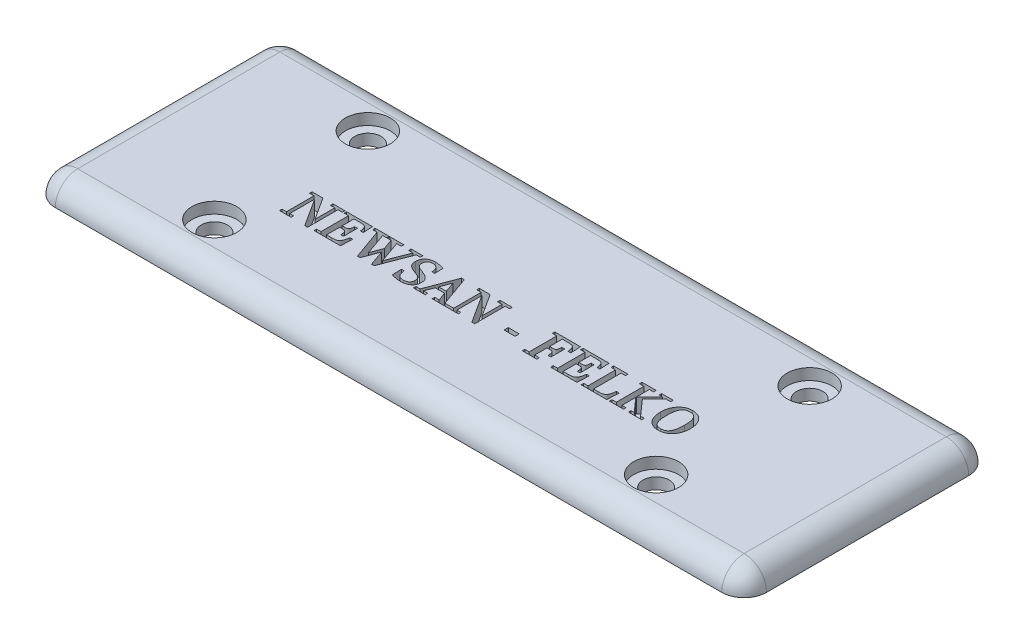
from build123d import *

# Parameters (mm, degrees)
CROQUIS1_W                = 95
CROQUIS1_H                = 33
SALIENTE_EXTRUIR1_DEPTH   = 3
CROQUIS2_R                = 1.75
CORTAR_EXTRUIR1_DEPTH     = 3
REDONDEO1_R               = 3
CORTAR_EXTRUIR2_START     = -2
CORTAR_EXTRUIR2_OUTLINE_W = 1.471220198
CORTAR_EXTRUIR2_OUTLINE_H = 0.565174626
CORTAR_EXTRUIR2_DEPTH     = 2
CROQUIS5_R                = 3
CORTAR_EXTRUIR3_DEPTH     = 1.5


# Read off the part's stored shape, not the designer's step: Cortar-Extruir2
with BuildPart() as part:
    # Croquis1 → Saliente-Extruir1 (new body)
    with BuildSketch(Plane(origin=(0, 0, 0), x_dir=(1, 0, 0), z_dir=(0, 1, 0))):
        Rectangle(CROQUIS1_W, CROQUIS1_H)
    extrude(amount=SALIENTE_EXTRUIR1_DEPTH)

    # Croquis2 → Cortar-Extruir1 (cut)
    with BuildSketch(Plane(origin=(0, 3, 0), x_dir=(1, 0, 0), z_dir=(0, 1, 0))):
        with Locations(Location((-29.5, 10.25, 0), (0, 0, 270))):
            Circle(CROQUIS2_R)
        with Locations(Location((-29.5, -10.25, 0), (0, 0, 270))):
            Circle(CROQUIS2_R)
        with Locations(Location((29.5, 10.25, 0), (0, 0, 270))):
            Circle(CROQUIS2_R)
        with Locations(Location((29.5, -10.25, 0), (0, 0, 270))):
            Circle(CROQUIS2_R)
    extrude(amount=-CORTAR_EXTRUIR1_DEPTH, mode=Mode.SUBTRACT)

    # Redondeo1
    redondeo1_edges = [part.edges().sort_by_distance(p)[0] for p in [
        (-47.5, 3, 0),
        (0, 3, 16.5),
        (47.5, 3, 0),
        (47.5, 1.5, 16.5),
        (-47.5, 1.5, 16.5),
        (-47.5, 1.5, -16.5),
        (47.5, 1.5, -16.5),
        (0, 3, -16.5),
    ]]
    fillet(redondeo1_edges, radius=REDONDEO1_R - 0.0001)  # a hair under: the kernel refuses the full size

    # Cortar-Extruir2 outline → Cortar-Extruir2 (cut)
    # profile 1 of 11: a face of its own
    with BuildSketch(Plane(origin=(0, 3, 0), x_dir=(1, 0, 0), z_dir=(0, 1, 0)).offset(CORTAR_EXTRUIR2_START)):
        with BuildLine():
            add(Edge.make_bspline(
                [(7.835082541, -2.552231705), (7.866288504, -2.552113847), (7.925474772, -2.551890313), (8.009068049, -2.548882373), (8.083044213, -2.5459401), (8.147689219, -2.540072055), (8.204919261, -2.530629364), (8.255269012, -2.515981768), (8.299614281, -2.49555415), (8.338205175, -2.468495475), (8.370599719, -2.432114827), (8.400430954, -2.387777593), (8.422836836, -2.331977531), (8.445401416, -2.265977584), (8.463525133, -2.183379744), (8.47880217, -2.081001435), (8.4916923, -1.956612994), (8.498255741, -1.866389899), (8.501811982, -1.817504692)],
                knots=[0, 0, 0, 0, 0.077872921, 0.147696373, 0.208740392, 0.262613455, 0.309594528, 0.353290378, 0.393054837, 0.43097135, 0.469961481, 0.51397114, 0.563648885, 0.619402434, 0.688009574, 0.774245034, 0.877680118, 1, 1, 1, 1], degree=3))
            Line((7.835082541, -2.552231705), (7.564858423, -2.552231705))
            Line((7.564858423, -2.552231705), (7.564858423, -0.856707828))
            Line((7.564858423, -0.856707828), (8.349921302, -0.856707828))
            add(Edge.make_bspline(
                [(9.363703287, -1.874022154), (9.356420458, -1.815981544), (9.342823038, -1.707616706), (9.318366911, -1.556693251), (9.291664283, -1.428944609), (9.262078086, -1.321808857), (9.229784985, -1.230873258), (9.189458998, -1.153614645), (9.144544526, -1.086293781), (9.092610664, -1.029418621), (9.032555359, -0.982754458), (8.96491433, -0.943158855), (8.887419443, -0.913858898), (8.801153012, -0.891699675), (8.704640053, -0.876826171), (8.597213604, -0.863745228), (8.477424181, -0.858675836), (8.393780831, -0.8573848), (8.349921302, -0.856707828)],
                knots=[0, 0, 0, 0, 0.104382199, 0.194886993, 0.272777312, 0.337141473, 0.393152238, 0.444605182, 0.492248799, 0.537232089, 0.581370096, 0.627501203, 0.676568608, 0.728679678, 0.786195024, 0.850702647, 0.921713901, 1, 1, 1, 1], degree=3))
            Line((9.363703287, -1.874022154), (9.731949879, -1.874022154))
            Line((9.731949879, -1.874022154), (9.663069221, -0.517603053))
            Line((9.663069221, -0.517603053), (6.239347309, -0.517603053))
            Line((6.239347309, -0.517603053), (6.239347309, -0.856707828))
            Line((6.239347309, -0.856707828), (6.824832898, -0.856707828))
            Line((6.824832898, -0.856707828), (6.824832898, -4.530342895))
            Line((6.824832898, -4.530342895), (6.239347309, -4.530342895))
            Line((6.239347309, -4.530342895), (6.239347309, -4.869447671))
            Line((6.239347309, -4.869447671), (8.178602743, -4.869447671))
            Line((8.178602743, -4.869447671), (8.178602743, -4.530342895))
            Line((8.178602743, -4.530342895), (7.564858423, -4.530342895))
            Line((7.564858423, -4.530342895), (7.564858423, -2.891336481))
            Line((7.564858423, -2.891336481), (7.835082541, -2.891336481))
            add(Edge.make_bspline(
                [(8.500928897, -3.682580957), (8.49796043, -3.63310797), (8.492442673, -3.54114809), (8.480893173, -3.413650898), (8.468637112, -3.307113751), (8.452565128, -3.219789064), (8.43388467, -3.148281025), (8.412354809, -3.087859967), (8.38502061, -3.038221891), (8.353335898, -2.997250043), (8.314796147, -2.96553747), (8.269455171, -2.940730304), (8.217233344, -2.921035443), (8.156844967, -2.909806022), (8.089023697, -2.900973612), (8.012375096, -2.895101878), (7.92666403, -2.891576316), (7.866583364, -2.891418976), (7.835082541, -2.891336481)],
                knots=[0, 0, 0, 0, 0.118776708, 0.220780927, 0.306799081, 0.375706699, 0.433376213, 0.483827635, 0.528984734, 0.568649537, 0.607220103, 0.647649254, 0.692072946, 0.740361906, 0.794441565, 0.856017857, 0.924508893, 1, 1, 1, 1], degree=3))
            Line((8.500928897, -3.682580957), (8.875357086, -3.682580957))
            Line((8.875357086, -3.682580957), (8.875357086, -1.817504692))
            Line((8.875357086, -1.817504692), (8.501811982, -1.817504692))
        make_face()
    # profile 2 of 11: a face of its own
    with BuildSketch(Plane(origin=(0, 3, 0), x_dir=(1, 0, 0), z_dir=(0, 1, 0)).offset(CORTAR_EXTRUIR2_START)):
        with BuildLine():
            add(Edge.make_bspline(
                [(11.621752533, -2.43919678), (11.652959095, -2.439081198), (11.712146498, -2.438861983), (11.79573225, -2.435825422), (11.869732046, -2.432973014), (11.93459281, -2.426800125), (11.99214388, -2.418185134), (12.042006815, -2.401632501), (12.086319973, -2.38172723), (12.124833344, -2.354533258), (12.157579152, -2.318105956), (12.186566297, -2.273266221), (12.209978149, -2.217671679), (12.23181563, -2.151372269), (12.250173593, -2.068887076), (12.265544721, -1.966794162), (12.278305763, -1.84298595), (12.284912257, -1.753059921), (12.288481975, -1.704469767)],
                knots=[0, 0, 0, 0, 0.077918038, 0.147781943, 0.208861328, 0.262765604, 0.310498151, 0.353734685, 0.393522182, 0.431460662, 0.470473383, 0.515123849, 0.564157341, 0.620640993, 0.689287881, 0.774847026, 0.878342037, 1, 1, 1, 1], degree=3))
            Line((11.621752533, -2.43919678), (11.351528415, -2.43919678))
            Line((11.351528415, -2.43919678), (11.351528415, -0.856707828))
            Line((11.351528415, -0.856707828), (12.165733111, -0.856707828))
            add(Edge.make_bspline(
                [(13.175099669, -1.817504692), (13.166967635, -1.763862747), (13.151687646, -1.663070207), (13.124285454, -1.5229055), (13.096578419, -1.403068763), (13.066719495, -1.301824405), (13.032219097, -1.216090898), (12.995154581, -1.140584045), (12.949567321, -1.077061803), (12.899407073, -1.022267291), (12.841292711, -0.977372591), (12.775169743, -0.939817417), (12.699469909, -0.910907252), (12.614157648, -0.890370995), (12.518840665, -0.874330837), (12.411964639, -0.864813032), (12.293011009, -0.85700623), (12.209609196, -0.856810695), (12.165733111, -0.856707828)],
                knots=[0, 0, 0, 0, 0.100276022, 0.188417382, 0.263906678, 0.327592325, 0.383263949, 0.434608959, 0.482616625, 0.527272883, 0.57146264, 0.617759396, 0.667371346, 0.720685132, 0.77972221, 0.84588167, 0.918921319, 1, 1, 1, 1], degree=3))
            Line((13.175099669, -1.817504692), (13.542463175, -1.817504692))
            Line((13.542463175, -1.817504692), (13.479764115, -0.517603053))
            Line((13.479764115, -0.517603053), (10.026017301, -0.517603053))
            Line((10.026017301, -0.517603053), (10.026017301, -0.856707828))
            Line((10.026017301, -0.856707828), (10.61150289, -0.856707828))
            Line((10.61150289, -0.856707828), (10.61150289, -4.530342895))
            Line((10.61150289, -4.530342895), (10.026017301, -4.530342895))
            Line((10.026017301, -4.530342895), (10.026017301, -4.869447671))
            Line((10.026017301, -4.869447671), (13.5530602, -4.869447671))
            Line((13.5530602, -4.869447671), (13.61575926, -3.286958719))
            Line((13.61575926, -3.286958719), (13.248395753, -3.286958719))
            add(Edge.make_bspline(
                [(12.01384243, -4.530342895), (12.050935719, -4.530272261), (12.122197606, -4.53013656), (12.224654922, -4.526377659), (12.318579198, -4.521118292), (12.429705821, -4.512537354), (12.554676943, -4.493761583), (12.689322561, -4.456662392), (12.804558265, -4.403059107), (12.885313216, -4.342725689), (12.94011006, -4.285563151), (12.977829431, -4.235810475), (13.013184662, -4.179936696), (13.046128662, -4.117283965), (13.07658388, -4.047473747), (13.106123948, -3.970848828), (13.131193459, -3.886163468), (13.155408694, -3.793105207), (13.178336733, -3.687827552), (13.202084485, -3.568333583), (13.225912679, -3.432891603), (13.240636129, -3.337324798), (13.248395753, -3.286958719)],
                knots=[0, 0, 0, 0, 0.05445262, 0.104611819, 0.150493048, 0.192553926, 0.268220917, 0.335654327, 0.396929789, 0.45371437, 0.482445036, 0.512956787, 0.545206301, 0.579422652, 0.616763016, 0.656973875, 0.699898362, 0.746331873, 0.798126817, 0.858046255, 0.925186852, 1, 1, 1, 1], degree=3))
            Line((12.01384243, -4.530342895), (11.351528415, -4.530342895))
            Line((11.351528415, -4.530342895), (11.351528415, -2.778301556))
            Line((11.351528415, -2.778301556), (11.621752533, -2.778301556))
            add(Edge.make_bspline(
                [(12.287598889, -3.569546032), (12.284624578, -3.520073768), (12.27909596, -3.428115232), (12.267641733, -3.300900451), (12.255228166, -3.19467753), (12.239240333, -3.107636587), (12.220553547, -3.03612932), (12.199025052, -2.975708101), (12.171690548, -2.926070042), (12.140005901, -2.885098251), (12.101466144, -2.853385447), (12.05612513, -2.828579219), (12.003903487, -2.808880362), (11.943514315, -2.797668087), (11.875696572, -2.788759618), (11.799018502, -2.783228766), (11.713363392, -2.778202476), (11.653258765, -2.778267481), (11.621752533, -2.778301556)],
                knots=[0, 0, 0, 0, 0.118856032, 0.220928374, 0.306303417, 0.375257054, 0.432965082, 0.483450198, 0.528637455, 0.568328747, 0.606925072, 0.647381224, 0.691834584, 0.740155793, 0.794271569, 0.855888985, 0.924458477, 1, 1, 1, 1], degree=3))
            Line((12.287598889, -3.569546032), (12.662027079, -3.569546032))
            Line((12.662027079, -3.569546032), (12.662027079, -1.704469767))
            Line((12.662027079, -1.704469767), (12.288481975, -1.704469767))
        make_face()
    # profile 3 of 11: a face of its own
    with BuildSketch(Plane(origin=(0, 3, 0), x_dir=(1, 0, 0), z_dir=(0, 1, 0)).offset(CORTAR_EXTRUIR2_START)):
        with BuildLine():
            add(Edge.make_bspline(
                [(15.9947912, -4.530342895), (16.031886137, -4.530302023), (16.103445412, -4.530223176), (16.206159412, -4.526044445), (16.300441138, -4.522282286), (16.411529282, -4.513276875), (16.536518596, -4.494710847), (16.671387249, -4.457386318), (16.787753514, -4.403585411), (16.870034086, -4.343055689), (16.926327034, -4.285593985), (16.964817981, -4.236238656), (17.00018691, -4.180604524), (17.03408479, -4.119517972), (17.0651941, -4.050360621), (17.093832869, -3.973295837), (17.120503051, -3.887473215), (17.145048266, -3.792189659), (17.169161263, -3.68533328), (17.191570286, -3.565030097), (17.214861898, -3.430879011), (17.228419898, -3.33645149), (17.23552612, -3.286958719)],
                knots=[0, 0, 0, 0, 0.054289296, 0.104728649, 0.150449938, 0.192384659, 0.267824697, 0.335055849, 0.396536747, 0.454444531, 0.483388805, 0.514073344, 0.545863236, 0.57980238, 0.616244569, 0.656737955, 0.700072516, 0.7477262, 0.800721224, 0.860378538, 0.926819501, 1, 1, 1, 1], degree=3))
            Line((15.9947912, -4.530342895), (15.420785721, -4.530342895))
            Line((15.420785721, -4.530342895), (15.420785721, -0.856707828))
            Line((15.420785721, -0.856707828), (16.005388224, -0.856707828))
            Line((16.005388224, -0.856707828), (16.005388224, -0.517603053))
            Line((16.005388224, -0.517603053), (14.095274606, -0.517603053))
            Line((14.095274606, -0.517603053), (14.095274606, -0.856707828))
            Line((14.095274606, -0.856707828), (14.680760195, -0.856707828))
            Line((14.680760195, -0.856707828), (14.680760195, -4.530342895))
            Line((14.680760195, -4.530342895), (14.095274606, -4.530342895))
            Line((14.095274606, -4.530342895), (14.095274606, -4.869447671))
            Line((14.095274606, -4.869447671), (17.53400897, -4.869447671))
            Line((17.53400897, -4.869447671), (17.602889627, -3.286958719))
            Line((17.602889627, -3.286958719), (17.23552612, -3.286958719))
        make_face()
    # profile 4 of 11: a face of its own
    with BuildSketch(Plane(origin=(0, 3, 0), x_dir=(1, 0, 0), z_dir=(0, 1, 0)).offset(CORTAR_EXTRUIR2_START)):
        with BuildLine():
            add(Edge.make_bspline(
                [(24.466228988, -4.982482596), (24.395161306, -4.98084055), (24.256186713, -4.977629488), (24.053124117, -4.945853801), (23.85989807, -4.898597975), (23.677928445, -4.828926583), (23.507889345, -4.741164859), (23.349355601, -4.636509128), (23.204352495, -4.513959128), (23.071714135, -4.375336077), (22.953564501, -4.22011666), (22.848440055, -4.049741034), (22.760256751, -3.863123608), (22.683186247, -3.663234225), (22.625005284, -3.448564465), (22.582664803, -3.221198121), (22.55669011, -2.981423061), (22.553388253, -2.817223112), (22.551699944, -2.733264203)],
                knots=[0, 0, 0, 0, 0.064052732, 0.125256685, 0.184949902, 0.243184605, 0.300538688, 0.357239491, 0.414146296, 0.471421664, 0.529941342, 0.58977551, 0.651644441, 0.715845572, 0.782770124, 0.851923218, 0.924285207, 1, 1, 1, 1], degree=3))
            add(Edge.make_bspline(
                [(26.489377531, -2.651137265), (26.487961572, -2.731855978), (26.485174417, -2.890741514), (26.459855601, -3.124590241), (26.418349533, -3.349478219), (26.361465534, -3.564986378), (26.28807347, -3.769070102), (26.200386607, -3.961202442), (26.093891164, -4.138396932), (25.974546558, -4.303517705), (25.837571879, -4.452777858), (25.684754035, -4.585618609), (25.516816919, -4.703463811), (25.364101969, -4.785453859), (25.235618609, -4.843451135), (25.134720478, -4.880004708), (25.031182832, -4.912392069), (24.924224578, -4.937430849), (24.814405038, -4.958272282), (24.701097712, -4.97183758), (24.584722312, -4.981252531), (24.505987345, -4.982069869), (24.466228988, -4.982482596)],
                knots=[0, 0, 0, 0, 0.069727241, 0.137250082, 0.20294958, 0.26717328, 0.329603704, 0.390143467, 0.449335206, 0.507939886, 0.565905272, 0.623950955, 0.68258488, 0.74279087, 0.773418736, 0.804318911, 0.835453715, 0.867100623, 0.899176948, 0.931986055, 0.965655378, 1, 1, 1, 1], degree=3))
            add(Edge.make_bspline(
                [(24.527161878, -0.404568128), (24.600566145, -0.406613079), (24.744804321, -0.410631374), (24.955686467, -0.441968278), (25.156300449, -0.494051226), (25.345069556, -0.567843401), (25.522282875, -0.658640292), (25.685534164, -0.766725988), (25.834324132, -0.891634638), (25.968854037, -1.032257284), (26.0881258, -1.188870188), (26.194268235, -1.358953396), (26.282629786, -1.544695425), (26.358077641, -1.74266619), (26.417045789, -1.953408339), (26.459401672, -2.175803204), (26.484086981, -2.40979122), (26.487588848, -2.56954052), (26.489377531, -2.651137265)],
                knots=[0, 0, 0, 0, 0.065594082, 0.128891289, 0.190095919, 0.250491485, 0.309685178, 0.367775572, 0.425115623, 0.482994079, 0.541358546, 0.600795024, 0.661872828, 0.724913567, 0.789971373, 0.857212468, 0.927066988, 1, 1, 1, 1], degree=3))
            add(Edge.make_bspline(
                [(22.551699944, -2.733264203), (22.553235755, -2.646349136), (22.556242523, -2.476189322), (22.584400818, -2.227887622), (22.628697837, -1.992541337), (22.692402153, -1.771229238), (22.773072202, -1.564450556), (22.867133253, -1.371728055), (22.977127897, -1.195222634), (23.101243441, -1.034432402), (23.238808203, -0.890100635), (23.390456546, -0.763710292), (23.55403595, -0.654734922), (23.730044523, -0.56428582), (23.916510475, -0.492649888), (24.112511169, -0.441360384), (24.317208483, -0.410863204), (24.456411876, -0.40668944), (24.527161878, -0.404568128)],
                knots=[0, 0, 0, 0, 0.07600561, 0.148801595, 0.218290823, 0.285281947, 0.349932467, 0.412233206, 0.472609267, 0.531531367, 0.58962847, 0.646665346, 0.703870537, 0.761222741, 0.81942076, 0.878255021, 0.938123222, 1, 1, 1, 1], degree=3))
        make_face()
        with BuildLine():
            add(Edge.make_bspline(
                [(24.506850914, -0.743672903), (24.454962477, -0.745249034), (24.353310879, -0.74833674), (24.205056598, -0.771067834), (24.064711375, -0.811792093), (23.956897776, -0.866733386), (23.875566723, -0.921389765), (23.817489254, -0.971679239), (23.760237764, -1.028188659), (23.706567339, -1.094173016), (23.654717145, -1.168725131), (23.60720858, -1.254477764), (23.562501746, -1.350426277), (23.521140373, -1.45696318), (23.482660788, -1.573735655), (23.451169734, -1.701847831), (23.421303519, -1.840051506), (23.397865575, -1.989553585), (23.379637497, -2.151334742), (23.365192534, -2.326525803), (23.357672048, -2.516252529), (23.356696025, -2.64759914), (23.3561907, -2.715602496)],
                knots=[0, 0, 0, 0, 0.060033413, 0.117607943, 0.173109435, 0.22841089, 0.256850895, 0.286336645, 0.31716911, 0.349838151, 0.38461155, 0.422132989, 0.463127675, 0.507029748, 0.554321777, 0.605299346, 0.659617346, 0.717917939, 0.780328288, 0.847997611, 0.921302327, 1, 1, 1, 1], degree=3))
            add(Edge.make_bspline(
                [(25.684886775, -2.674097484), (25.684413766, -2.609623336), (25.683497601, -2.484744207), (25.675468063, -2.303612042), (25.662524514, -2.134509733), (25.643899271, -1.977245784), (25.621205733, -1.83106894), (25.593735601, -1.696203217), (25.563469506, -1.57177508), (25.527178685, -1.458660508), (25.486782901, -1.355879009), (25.445999289, -1.261617553), (25.39701747, -1.179400611), (25.347150815, -1.105216363), (25.292545656, -1.040551845), (25.236007027, -0.982814773), (25.176589839, -0.931854129), (25.113505704, -0.888640516), (25.047537329, -0.851325806), (24.978996742, -0.819233135), (24.906301843, -0.794513152), (24.804733113, -0.768948669), (24.671059802, -0.747881749), (24.562278138, -0.745093561), (24.506850914, -0.743672903)],
                knots=[0, 0, 0, 0, 0.074972217, 0.145212699, 0.210794604, 0.272147781, 0.32932531, 0.382762456, 0.432160301, 0.47816842, 0.520759141, 0.560590473, 0.597402379, 0.631868439, 0.664432592, 0.69565765, 0.725768974, 0.755298762, 0.784425026, 0.813831549, 0.843168258, 0.873554612, 0.935572627, 1, 1, 1, 1], degree=3))
            add(Edge.make_bspline(
                [(24.480358354, -4.64337782), (24.536944307, -4.641863125), (24.647114241, -4.638914091), (24.782170741, -4.619344044), (24.884281634, -4.593217012), (24.95694148, -4.567787005), (25.027173016, -4.536547049), (25.094001025, -4.498291186), (25.159203741, -4.454390307), (25.220072169, -4.401526122), (25.278432886, -4.342108199), (25.334752325, -4.275649796), (25.386689796, -4.199590451), (25.436927262, -4.115029551), (25.479721621, -4.018849064), (25.522126149, -3.914468401), (25.558889063, -3.798974573), (25.591309959, -3.672738976), (25.619299333, -3.535656432), (25.643425514, -3.38753279), (25.661345334, -3.22716658), (25.67581496, -3.054345213), (25.683408342, -2.868444913), (25.684382897, -2.740334818), (25.684886775, -2.674097484)],
                knots=[0, 0, 0, 0, 0.064489388, 0.125557513, 0.155015933, 0.184514449, 0.213198429, 0.242495914, 0.272182727, 0.302642504, 0.334196862, 0.367060094, 0.401775644, 0.4390645, 0.478994874, 0.521610414, 0.567447055, 0.617005525, 0.670106882, 0.726865271, 0.788000641, 0.853980099, 0.924502679, 1, 1, 1, 1], degree=3))
            add(Edge.make_bspline(
                [(23.3561907, -2.715602496), (23.356625303, -2.782139624), (23.357464076, -2.910554591), (23.365922982, -3.096045352), (23.377273621, -3.267900143), (23.39637422, -3.426278208), (23.418738865, -3.572865962), (23.447390826, -3.707936372), (23.478845257, -3.833050282), (23.514689649, -3.947923091), (23.555301973, -4.051858584), (23.598574426, -4.145586935), (23.645190828, -4.228597746), (23.694903861, -4.302077429), (23.748206084, -4.36565792), (23.803274163, -4.421595419), (23.859681067, -4.470915386), (23.938609961, -4.524488453), (24.04324481, -4.577310493), (24.179037255, -4.618108606), (24.325678725, -4.639862702), (24.427299405, -4.642172047), (24.480358354, -4.64337782)],
                knots=[0, 0, 0, 0, 0.078657401, 0.151806784, 0.219496477, 0.282217665, 0.340347994, 0.394745788, 0.445389451, 0.492827568, 0.536902847, 0.57722709, 0.614781646, 0.649338274, 0.681954902, 0.712715998, 0.742083255, 0.770366505, 0.825305959, 0.879907089, 0.937296193, 1, 1, 1, 1], degree=3))
        make_face(mode=Mode.SUBTRACT)
    # profile 5 of 11: a face of its own
    with BuildSketch(Plane(origin=(0, 3, 0), x_dir=(1, 0, 0), z_dir=(0, 1, 0)).offset(CORTAR_EXTRUIR2_START)):
        with BuildLine():
            add(Edge.make_bspline(
                [(-10.891625448, -3.513028569), (-10.884983123, -3.573173923), (-10.872394696, -3.687160428), (-10.843672534, -3.846893359), (-10.807928341, -3.985864073), (-10.764970196, -4.10498613), (-10.713785072, -4.206093813), (-10.66152868, -4.295204136), (-10.603738516, -4.371945156), (-10.541593659, -4.436979002), (-10.475429669, -4.491290304), (-10.406635581, -4.536726858), (-10.333790337, -4.572430173), (-10.257663459, -4.599963479), (-10.177465881, -4.618772882), (-10.094298088, -4.632897638), (-10.007570476, -4.642158595), (-9.948514088, -4.642966664), (-9.918465389, -4.64337782)],
                knots=[0, 0, 0, 0, 0.107965712, 0.204614875, 0.289346858, 0.363804405, 0.430054362, 0.491315945, 0.547945155, 0.601074609, 0.651452717, 0.700408463, 0.747864388, 0.795886799, 0.844557054, 0.894646758, 0.946394828, 1, 1, 1, 1], degree=3))
            Line((-10.891625448, -3.513028569), (-11.258988955, -3.513028569))
            Line((-11.258988955, -3.513028569), (-11.220133199, -4.754646575))
            add(Edge.make_bspline(
                [(-9.95643806, -4.982482596), (-10.008561911, -4.981856706), (-10.114404875, -4.98058577), (-10.27436205, -4.968322691), (-10.437074962, -4.950191178), (-10.599002704, -4.923706102), (-10.756080204, -4.89187386), (-10.908621179, -4.857552487), (-11.062753673, -4.812698569), (-11.165614226, -4.774756783), (-11.220133199, -4.754646575)],
                knots=[0, 0, 0, 0, 0.121139214, 0.245985918, 0.372701109, 0.501612211, 0.627212255, 0.745219209, 0.864959046, 1, 1, 1, 1], degree=3))
            add(Edge.make_bspline(
                [(-8.378364534, -3.717021285), (-8.379430978, -3.764189326), (-8.381520123, -3.856590655), (-8.401467654, -3.991589831), (-8.433956845, -4.119596024), (-8.480060138, -4.240148079), (-8.538720075, -4.353007122), (-8.609452923, -4.458246214), (-8.694783155, -4.553826126), (-8.790763508, -4.642748277), (-8.900148346, -4.720852177), (-9.020067541, -4.790782977), (-9.152521605, -4.847981933), (-9.294431587, -4.898054666), (-9.447151902, -4.935489479), (-9.60890872, -4.962510296), (-9.779738897, -4.979865491), (-9.896639726, -4.981596918), (-9.95643806, -4.982482596)],
                knots=[0, 0, 0, 0, 0.061917728, 0.121295699, 0.178776797, 0.235068933, 0.290403661, 0.345520511, 0.401130082, 0.458319197, 0.51701611, 0.577294735, 0.640298906, 0.706201906, 0.774746421, 0.846505096, 0.921482683, 1, 1, 1, 1], degree=3))
            add(Edge.make_bspline(
                [(-9.600554662, -2.389744), (-9.524142129, -2.419929086), (-9.372951631, -2.479653557), (-9.187552472, -2.560143903), (-9.044908474, -2.630140754), (-8.943815131, -2.689521271), (-8.848142562, -2.75591954), (-8.75837522, -2.829085655), (-8.674215256, -2.908400627), (-8.600237626, -2.996959344), (-8.535340746, -3.093224662), (-8.478968701, -3.197184805), (-8.433372944, -3.311334335), (-8.401112171, -3.436494865), (-8.381317909, -3.573035507), (-8.379374312, -3.667791649), (-8.378364534, -3.717021285)],
                knots=[0, 0, 0, 0, 0.12623985, 0.249779259, 0.310463001, 0.370272329, 0.429745493, 0.489225536, 0.548088419, 0.60715947, 0.666121324, 0.726225806, 0.788547809, 0.854482743, 0.924397917, 1, 1, 1, 1], degree=3))
            add(Edge.make_bspline(
                [(-10.580779404, -1.464270551), (-10.580013467, -1.499638688), (-10.578552173, -1.567115836), (-10.565452071, -1.66282323), (-10.54362556, -1.748112447), (-10.512281837, -1.823436985), (-10.472799326, -1.890479098), (-10.426095479, -1.951143521), (-10.373131416, -2.006829514), (-10.313001324, -2.05754925), (-10.246668813, -2.104287551), (-10.17354309, -2.147290962), (-10.095081637, -2.189017853), (-10.009571581, -2.227805777), (-9.91671856, -2.265275464), (-9.817822779, -2.306069896), (-9.711385315, -2.34745429), (-9.638248325, -2.37536121), (-9.600554662, -2.389744)],
                knots=[0, 0, 0, 0, 0.07235237, 0.138037569, 0.197215327, 0.252034976, 0.304417265, 0.355986131, 0.408396124, 0.461387991, 0.516711746, 0.574257236, 0.634888912, 0.698505626, 0.766300592, 0.839797535, 0.917434151, 1, 1, 1, 1], degree=3))
            add(Edge.make_bspline(
                [(-9.818676745, -0.743672903), (-9.850198762, -0.744053974), (-9.911022904, -0.74478928), (-9.998646914, -0.753969316), (-10.079040373, -0.767648795), (-10.152105667, -0.787047384), (-10.218766079, -0.81204133), (-10.279275851, -0.842872691), (-10.335164739, -0.878638115), (-10.385492585, -0.919937948), (-10.42991469, -0.967393738), (-10.469562317, -1.020100194), (-10.50280535, -1.079692827), (-10.531299014, -1.145251678), (-10.553088543, -1.217005621), (-10.568937935, -1.294448418), (-10.578690057, -1.377482108), (-10.580070107, -1.434807374), (-10.580779404, -1.464270551)],
                knots=[0, 0, 0, 0, 0.078682006, 0.151822946, 0.219739189, 0.282145484, 0.340303312, 0.397174116, 0.45140917, 0.505713914, 0.559272287, 0.613372682, 0.669991159, 0.729253348, 0.791564333, 0.856868676, 0.92643552, 1, 1, 1, 1], degree=3))
            add(Edge.make_bspline(
                [(-8.917929685, -1.760987229), (-8.923570191, -1.705590497), (-8.934230277, -1.600895281), (-8.957410849, -1.454292062), (-8.991273816, -1.328562536), (-9.03101528, -1.22177685), (-9.077059035, -1.130696828), (-9.127159524, -1.052032825), (-9.181574284, -0.983860681), (-9.239931233, -0.925926282), (-9.302945298, -0.878197506), (-9.367983766, -0.83636926), (-9.438578757, -0.806216614), (-9.535683681, -0.774353418), (-9.662888327, -0.749128133), (-9.76645337, -0.745501605), (-9.818676745, -0.743672903)],
                knots=[0, 0, 0, 0, 0.108739489, 0.205508589, 0.289450972, 0.36258282, 0.427622094, 0.488374484, 0.544392793, 0.597641091, 0.648460434, 0.698546265, 0.748214733, 0.797839941, 0.89805942, 1, 1, 1, 1], degree=3))
            Line((-8.917929685, -1.760987229), (-8.547916922, -1.760987229))
            Line((-8.547916922, -1.760987229), (-8.585006507, -0.627105636))
            add(Edge.make_bspline(
                [(-9.798365781, -0.404568128), (-9.752130263, -0.405279202), (-9.656309834, -0.406752862), (-9.509661981, -0.418237015), (-9.35829409, -0.433794341), (-9.20776749, -0.459473865), (-9.06145944, -0.487569598), (-8.94259242, -0.51679848), (-8.846094252, -0.542730455), (-8.766411007, -0.566951316), (-8.678320414, -0.595016223), (-8.617049574, -0.616086451), (-8.585006507, -0.627105636)],
                knots=[0, 0, 0, 0, 0.111895749, 0.231897445, 0.355897725, 0.480057559, 0.601342597, 0.71643192, 0.77623362, 0.84318026, 0.917987327, 1, 1, 1, 1], degree=3))
            add(Edge.make_bspline(
                [(-11.227197882, -1.66384784), (-11.225875566, -1.618178573), (-11.223273131, -1.528297454), (-11.206754823, -1.396247664), (-11.177164677, -1.27047143), (-11.137573878, -1.150490704), (-11.086670297, -1.037358836), (-11.02361352, -0.932359685), (-10.948912261, -0.836563731), (-10.863232665, -0.749261304), (-10.766864119, -0.670519651), (-10.659228109, -0.601439155), (-10.541060402, -0.542152209), (-10.412308408, -0.492916298), (-10.273301531, -0.452773358), (-10.123592301, -0.425486301), (-9.964265054, -0.406870838), (-9.854645932, -0.405349306), (-9.798365781, -0.404568128)],
                knots=[0, 0, 0, 0, 0.063530284, 0.125033166, 0.184725257, 0.242991791, 0.300531575, 0.356919108, 0.412941235, 0.469112795, 0.526731195, 0.585677141, 0.646654394, 0.71029937, 0.77717236, 0.84759989, 0.921755429, 1, 1, 1, 1], degree=3))
            add(Edge.make_bspline(
                [(-10.050045107, -2.95226937), (-10.123242765, -2.924499338), (-10.269808663, -2.868894559), (-10.449869991, -2.792126335), (-10.590376701, -2.725686101), (-10.688554784, -2.667244926), (-10.782056166, -2.60500617), (-10.868261801, -2.535201172), (-10.948231742, -2.459235352), (-11.017601358, -2.37364493), (-11.080011099, -2.281501007), (-11.133839161, -2.180745879), (-11.176728556, -2.069155636), (-11.206321687, -1.945083331), (-11.223763344, -1.808583343), (-11.226023104, -1.713354379), (-11.227197882, -1.66384784)],
                knots=[0, 0, 0, 0, 0.123807193, 0.247902909, 0.309534555, 0.369419997, 0.428430407, 0.487033545, 0.544652, 0.602533177, 0.660897272, 0.720461543, 0.782799531, 0.849420035, 0.921718219, 1, 1, 1, 1], degree=3))
            add(Edge.make_bspline(
                [(-9.053924829, -3.882158246), (-9.054665725, -3.847372704), (-9.0560782, -3.781056107), (-9.069593754, -3.686320506), (-9.090889689, -3.601216581), (-9.1225558, -3.525395305), (-9.162473303, -3.457607013), (-9.207920875, -3.394226357), (-9.262835248, -3.337926324), (-9.323380615, -3.285329948), (-9.390975498, -3.23642386), (-9.466461459, -3.191820009), (-9.548701102, -3.149286145), (-9.671192584, -3.095678597), (-9.839178555, -3.030511211), (-9.97756365, -2.979163548), (-10.050045107, -2.95226937)],
                knots=[0, 0, 0, 0, 0.070332836, 0.134085429, 0.193160766, 0.247351868, 0.299648065, 0.352056031, 0.404707034, 0.458319169, 0.514185815, 0.573216113, 0.6355398, 0.701385708, 0.84359588, 1, 1, 1, 1], degree=3))
            add(Edge.make_bspline(
                [(-9.918465389, -4.64337782), (-9.880459643, -4.642787001), (-9.807233456, -4.641648661), (-9.702246177, -4.630594231), (-9.606169272, -4.614908119), (-9.519734651, -4.589574918), (-9.441682137, -4.558783435), (-9.371251489, -4.522369765), (-9.308076388, -4.480763732), (-9.25195076, -4.433732938), (-9.203057009, -4.381226625), (-9.160985331, -4.323667261), (-9.127788376, -4.260157538), (-9.100014565, -4.192518351), (-9.079186727, -4.120202), (-9.064226487, -4.043977313), (-9.055183239, -3.964210951), (-9.054349559, -3.909852103), (-9.053924829, -3.882158246)],
                knots=[0, 0, 0, 0, 0.08652257, 0.166704213, 0.240218807, 0.307902186, 0.371391851, 0.431060807, 0.488142918, 0.543335638, 0.597409583, 0.651183484, 0.705170088, 0.760195626, 0.817474233, 0.876243863, 0.936950748, 1, 1, 1, 1], degree=3))
        make_face()
    # profile 6 of 11: a face of its own
    with BuildSketch(Plane(origin=(0, 3, 0), x_dir=(1, 0, 0), z_dir=(0, 1, 0)).offset(CORTAR_EXTRUIR2_START)):
        with BuildLine():
            add(Edge.make_bspline(
                [(-19.971509044, -2.43919678), (-19.940302483, -2.439081198), (-19.881115079, -2.438861983), (-19.797529328, -2.435825422), (-19.723529532, -2.432973014), (-19.658668768, -2.426800125), (-19.601117698, -2.418185134), (-19.551254763, -2.401632501), (-19.506941605, -2.38172723), (-19.468428234, -2.354533258), (-19.435682425, -2.318105956), (-19.406695281, -2.273266221), (-19.383283429, -2.217671679), (-19.361445947, -2.151372269), (-19.343087985, -2.068887076), (-19.327716857, -1.966794162), (-19.314955815, -1.84298595), (-19.308349321, -1.753059921), (-19.304779603, -1.704469767)],
                knots=[0, 0, 0, 0, 0.077918038, 0.147781943, 0.208861328, 0.262765604, 0.310498151, 0.353734685, 0.393522182, 0.431460662, 0.470473383, 0.515123849, 0.564157341, 0.620640993, 0.689287881, 0.774847026, 0.878342037, 1, 1, 1, 1], degree=3))
            Line((-19.971509044, -2.43919678), (-20.241733162, -2.43919678))
            Line((-20.241733162, -2.43919678), (-20.241733162, -0.856707828))
            Line((-20.241733162, -0.856707828), (-19.427528467, -0.856707828))
            add(Edge.make_bspline(
                [(-18.418161909, -1.817504692), (-18.426293943, -1.763862747), (-18.441573931, -1.663070207), (-18.468976124, -1.5229055), (-18.496683159, -1.403068763), (-18.526542083, -1.301824405), (-18.561042481, -1.216090898), (-18.598106997, -1.140584045), (-18.643694257, -1.077061803), (-18.693854505, -1.022267291), (-18.751968867, -0.977372591), (-18.818091835, -0.939817417), (-18.893791669, -0.910907252), (-18.97910393, -0.890370995), (-19.074420913, -0.874330837), (-19.181296938, -0.864813032), (-19.300250569, -0.85700623), (-19.383652382, -0.856810695), (-19.427528467, -0.856707828)],
                knots=[0, 0, 0, 0, 0.100276022, 0.188417382, 0.263906678, 0.327592325, 0.383263949, 0.434608959, 0.482616625, 0.527272883, 0.57146264, 0.617759396, 0.667371346, 0.720685132, 0.77972221, 0.84588167, 0.918921319, 1, 1, 1, 1], degree=3))
            Line((-18.418161909, -1.817504692), (-18.050798402, -1.817504692))
            Line((-18.050798402, -1.817504692), (-18.113497462, -0.517603053))
            Line((-18.113497462, -0.517603053), (-21.567244277, -0.517603053))
            Line((-21.567244277, -0.517603053), (-21.567244277, -0.856707828))
            Line((-21.567244277, -0.856707828), (-20.981758688, -0.856707828))
            Line((-20.981758688, -0.856707828), (-20.981758688, -4.530342895))
            Line((-20.981758688, -4.530342895), (-21.567244277, -4.530342895))
            Line((-21.567244277, -4.530342895), (-21.567244277, -4.869447671))
            Line((-21.567244277, -4.869447671), (-18.040201378, -4.869447671))
            Line((-18.040201378, -4.869447671), (-17.977502318, -3.286958719))
            Line((-17.977502318, -3.286958719), (-18.344865825, -3.286958719))
            add(Edge.make_bspline(
                [(-19.579419148, -4.530342895), (-19.542325859, -4.530272261), (-19.471063972, -4.53013656), (-19.368606656, -4.526377659), (-19.27468238, -4.521118292), (-19.163555757, -4.512537354), (-19.038584634, -4.493761583), (-18.903939017, -4.456662392), (-18.788703313, -4.403059107), (-18.707948362, -4.342725689), (-18.653151517, -4.285563151), (-18.615432147, -4.235810475), (-18.580076916, -4.179936696), (-18.547132916, -4.117283965), (-18.516677698, -4.047473747), (-18.48713763, -3.970848828), (-18.462068119, -3.886163468), (-18.437852884, -3.793105207), (-18.414924845, -3.687827552), (-18.391177093, -3.568333583), (-18.367348898, -3.432891603), (-18.352625448, -3.337324798), (-18.344865825, -3.286958719)],
                knots=[0, 0, 0, 0, 0.05445262, 0.104611819, 0.150493048, 0.192553926, 0.268220917, 0.335654327, 0.396929789, 0.45371437, 0.482445036, 0.512956787, 0.545206301, 0.579422652, 0.616763016, 0.656973875, 0.699898362, 0.746331873, 0.798126817, 0.858046255, 0.925186852, 1, 1, 1, 1], degree=3))
            Line((-19.579419148, -4.530342895), (-20.241733162, -4.530342895))
            Line((-20.241733162, -4.530342895), (-20.241733162, -2.778301556))
            Line((-20.241733162, -2.778301556), (-19.971509044, -2.778301556))
            add(Edge.make_bspline(
                [(-19.305662689, -3.569546032), (-19.308636999, -3.520073768), (-19.314165618, -3.428115232), (-19.325619845, -3.300900451), (-19.338033412, -3.19467753), (-19.354021245, -3.107636587), (-19.372708031, -3.03612932), (-19.394236526, -2.975708101), (-19.42157103, -2.926070042), (-19.453255676, -2.885098251), (-19.491795434, -2.853385447), (-19.537136448, -2.828579219), (-19.589358091, -2.808880362), (-19.649747263, -2.797668087), (-19.717565005, -2.788759618), (-19.794243076, -2.783228766), (-19.879898186, -2.778202476), (-19.940002812, -2.778267481), (-19.971509044, -2.778301556)],
                knots=[0, 0, 0, 0, 0.118856032, 0.220928374, 0.306303417, 0.375257054, 0.432965082, 0.483450198, 0.528637455, 0.568328747, 0.606925072, 0.647381224, 0.691834584, 0.740155793, 0.794271569, 0.855888985, 0.924458477, 1, 1, 1, 1], degree=3))
            Line((-19.305662689, -3.569546032), (-18.931234499, -3.569546032))
            Line((-18.931234499, -3.569546032), (-18.931234499, -1.704469767))
            Line((-18.931234499, -1.704469767), (-19.304779603, -1.704469767))
        make_face()
    # profile 7 of 11: a face of its own
    with BuildSketch(Plane(origin=(0, 3, 0), x_dir=(1, 0, 0), z_dir=(0, 1, 0)).offset(CORTAR_EXTRUIR2_START)):
        Polygon((20.502941925, -0.856707828), (20.945367687, -0.856707828), (19.207455713, -2.570624962), (19.207455713, -0.856707828), (19.7629164, -0.856707828), (19.7629164, -0.517603053), (17.881944599, -0.517603053), (17.881944599, -0.856707828), (18.467430187, -0.856707828), (18.467430187, -4.530342895), (17.881944599, -4.530342895), (17.881944599, -4.869447671), (19.7629164, -4.869447671), (19.7629164, -4.530342895), (19.207455713, -4.530342895), (19.207455713, -2.682147235), (20.859708408, -4.530342895), (20.421698073, -4.530342895), (20.421698073, -4.869447671), (22.205530485, -4.869447671), (22.205530485, -4.530342895), (21.702171834, -4.530342895), (19.842394082, -2.428599756), (21.407221327, -0.856707828), (22.050990549, -0.856707828), (22.050990549, -0.517603053), (20.502941925, -0.517603053), align=None)
    # profile 8 of 11: a face of its own
    with BuildSketch(Plane(origin=(0, 3, 0), x_dir=(1, 0, 0), z_dir=(0, 1, 0)).offset(CORTAR_EXTRUIR2_START)):
        Polygon((-17.763795663, -0.856707828), (-17.168596135, -0.856707828), (-15.712388388, -4.925965133), (-15.356504991, -4.925965133), (-14.562627366, -2.841829195), (-13.840247441, -4.925965133), (-13.484364044, -4.925965133), (-11.933666164, -0.856707828), (-11.384387075, -0.856707828), (-11.384387075, -0.517603053), (-12.94921432, -0.517603053), (-12.94921432, -0.856707828), (-12.363728731, -0.856707828), (-13.510049523, -3.7891365), (-14.537884869, -0.856707828), (-13.929439061, -0.856707828), (-13.929439061, -0.517603053), (-15.804229265, -0.517603053), (-15.804229265, -0.856707828), (-15.296455187, -0.856707828), (-14.792213451, -2.259047368), (-15.38242674, -3.788462421), (-16.410025817, -0.856707828), (-15.889005459, -0.856707828), (-15.889005459, -0.517603053), (-17.763795663, -0.517603053), align=None)
    # profile 9 of 11: a face of its own
    with BuildSketch(Plane(origin=(0, 3, 0), x_dir=(1, 0, 0), z_dir=(0, 1, 0)).offset(CORTAR_EXTRUIR2_START)):
        Polygon((-3.849902846, -0.856707828), (-3.264417257, -0.856707828), (-3.264417257, -4.530342895), (-4.42479141, -4.530342895), (-5.852740426, -0.517603053), (-6.215688506, -0.517603053), (-7.736361483, -4.530342895), (-8.309483877, -4.530342895), (-8.309483877, -4.869447671), (-6.715514815, -4.869447671), (-6.715514815, -4.530342895), (-7.301000404, -4.530342895), (-6.857691557, -3.399993644), (-5.609008868, -3.399993644), (-5.186010984, -4.530342895), (-5.794456792, -4.530342895), (-5.794456792, -4.869447671), (-2.305386564, -4.869447671), (-2.305386564, -4.530342895), (-2.831705434, -4.530342895), (-2.831705434, -1.196315107), (-0.43059636, -4.925965133), (-0.052635829, -4.925965133), (-0.052635829, -0.856707828), (0.531966674, -0.856707828), (0.531966674, -0.517603053), (-1.070833241, -0.517603053), (-1.070833241, -0.856707828), (-0.485347652, -0.856707828), (-0.485347652, -3.503740444), (-2.40870755, -0.517603053), (-3.849902846, -0.517603053), align=None)
        Polygon((-5.706148257, -3.060888868), (-6.744656632, -3.060888868), (-6.201841391, -1.674857667), align=None, mode=Mode.SUBTRACT)
    # profile 10 of 11: a face of its own
    with BuildSketch(Plane(origin=(0, 3, 0), x_dir=(1, 0, 0), z_dir=(0, 1, 0)).offset(CORTAR_EXTRUIR2_START)):
        Polygon((-26.174300562, -0.856707828), (-25.588814973, -0.856707828), (-25.588814973, -4.530342895), (-26.174300562, -4.530342895), (-26.174300562, -4.869447671), (-24.62978428, -4.869447671), (-24.62978428, -4.530342895), (-25.15610315, -4.530342895), (-25.15610315, -1.196315107), (-22.754994076, -4.925965133), (-22.377033545, -4.925965133), (-22.377033545, -0.856707828), (-21.792431042, -0.856707828), (-21.792431042, -0.517603053), (-23.395230957, -0.517603053), (-23.395230957, -0.856707828), (-22.809745368, -0.856707828), (-22.809745368, -3.503740444), (-24.733105266, -0.517603053), (-26.174300562, -0.517603053), align=None)
    # profile 11 of 11: a face of its own
    with BuildSketch(Plane(origin=(0, 3, 0), x_dir=(1, 0, 0), z_dir=(0, 1, 0)).offset(CORTAR_EXTRUIR2_START)):
        with Locations((3.353424376, -3.399993644)):
            Rectangle(CORTAR_EXTRUIR2_OUTLINE_W, CORTAR_EXTRUIR2_OUTLINE_H)
    extrude(amount=CORTAR_EXTRUIR2_DEPTH, mode=Mode.SUBTRACT)

    # Croquis5 → Cortar-Extruir3 (cut)
    with BuildSketch(Plane(origin=(0, 3, 0), x_dir=(1, 0, 0), z_dir=(0, 1, 0))):
        with Locations(Location((-29.5, 10.25, 0), (0, 0, 270))):
            Circle(CROQUIS5_R)
        with Locations(Location((29.5, 10.25, 0), (0, 0, 270))):
            Circle(CROQUIS5_R)
        with Locations(Location((29.5, -10.25, 0), (0, 0, 270))):
            Circle(CROQUIS5_R)
        with Locations(Location((-29.5, -10.25, 0), (0, 0, 270))):
            Circle(CROQUIS5_R)
    extrude(amount=-CORTAR_EXTRUIR3_DEPTH, mode=Mode.SUBTRACT)


solid = part.part
